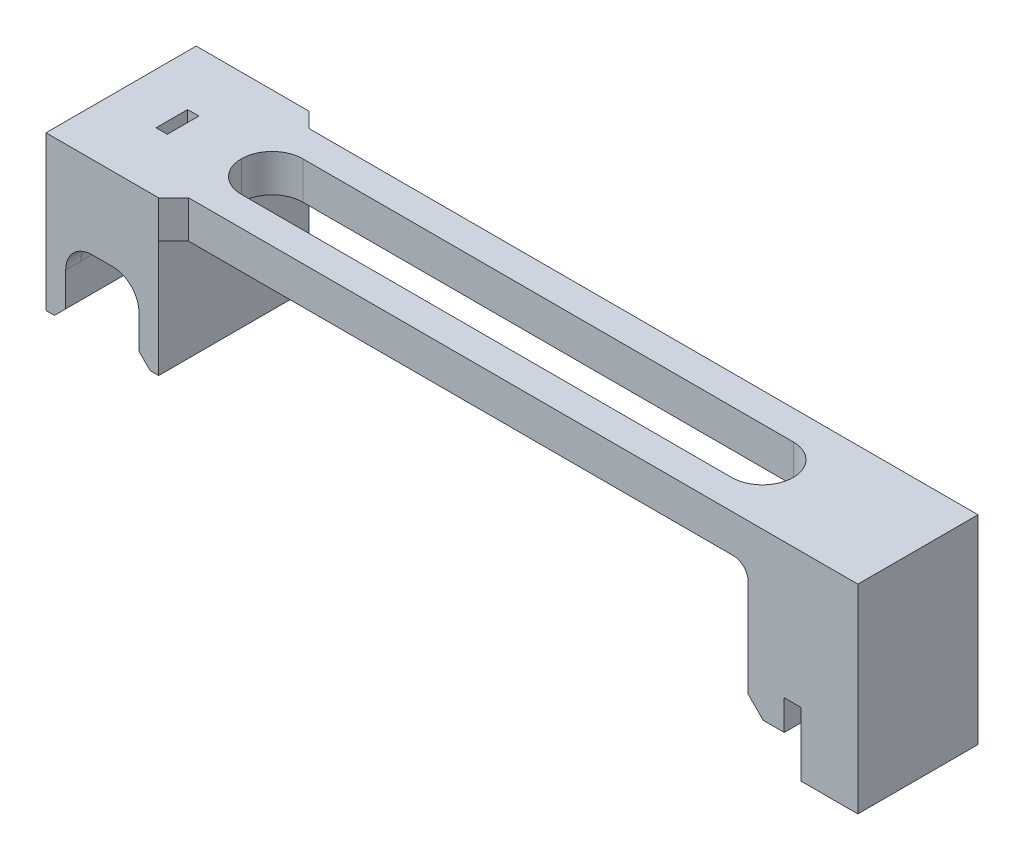
from build123d import *

# Parameters (mm, degrees)
EXTRUDE_1_DEPTH      = 16
SKETCH_4_W           = 1.5
SKETCH_4_H           = 4.2
SKETCH_4_W_2         = 73.5
SKETCH_4_H_2         = 8.2
CUT_EXTRUDE_1_DEPTH  = 10
FILLET_1_R           = 4.1
SKETCH_6_W           = 10
SKETCH_6_H           = 16
SKETCH_6_W_2         = 1.5
SKETCH_6_H_2         = 4.2
EXTRUDE_4_DEPTH      = 11
EXTRUDE_6_DEPTH      = 13
EXTRUDE_6_DEPTH_BACK = 11
SKETCH_10_W          = 0.125
SKETCH_10_H          = 16
SKETCH_10_W_2        = 2.5
FILLET_2_R           = 3.5
EXTRUDE_7_DEPTH      = 2
EXTRUDE_8_DEPTH      = 2
FILLET_4_R           = 3.5
CUT_EXTRUDE_START    = -15
SKETCH_13_W          = 20
SKETCH_13_H          = 3.5
CUT_EXTRUDE_2_DEPTH  = 15
CHAMFER_1_SIZE       = 2
CHAMFER_2_SIZE       = 1.5
SKETCH_14_W          = 7
SKETCH_14_H          = 16
EXTRUDE_9_DEPTH      = 13
SKETCH_15_W          = 4.8
SKETCH_15_H          = 16
EXTRUDE_10_DEPTH     = 4
FILLET_5_R           = 2
CHAMFER_3_SIZE       = 2


with BuildPart() as part:
    # 스케치1 → 보스-돌출1 (new body)
    with BuildSketch(Plane.XY):
        Polygon((-96, 0), (0, 0), (0, -21.5), (7.6, -21.5), (7.6, 5), (-96, 5), align=None)
    extrude(amount=EXTRUDE_1_DEPTH)

    # 스케치4 → 컷-돌출1 (cut)
    with BuildSketch(Plane.XZ):
        with Locations((-91, 8)):
            Rectangle(SKETCH_4_W, SKETCH_4_H)
        with Locations((-45.75, 8)):
            Rectangle(SKETCH_4_W_2, SKETCH_4_H_2)
    extrude(amount=-CUT_EXTRUDE_1_DEPTH, mode=Mode.SUBTRACT)

    # 필렛1
    fillet_1_edges = [part.edges().sort_by_distance(p)[0] for p in [
        (-82.5, 2.5, 3.9),
        (-82.5, 2.5, 12.1),
        (-9, 2.5, 3.9),
        (-9, 2.5, 12.1),
    ]]
    fillet(fillet_1_edges, radius=FILLET_1_R - 0.0001)  # a hair under: the kernel refuses the full size

    # 스케치6 → 보스-돌출4 (add)
    with BuildSketch(Plane(origin=(0, 5, 0), x_dir=(1, 0, 0), z_dir=(0, 1, 0))):
        with Locations((-91, -8)):
            Rectangle(SKETCH_6_W, SKETCH_6_H)
        with Locations((-91, -8)):
            Rectangle(SKETCH_6_W_2, SKETCH_6_H_2, mode=Mode.SUBTRACT)
    extrude(amount=-EXTRUDE_4_DEPTH)

    # 스케치10 → 보스-돌출6 (add, two sides: drawn at the far end of the back side and taken through both)
    with BuildSketch(Plane.XZ.offset(6).offset(-EXTRUDE_6_DEPTH_BACK)):
        with Locations((-95.9375, 8)):
            Rectangle(SKETCH_10_W, SKETCH_10_H)
        with Locations((-97.25, 8)):
            Rectangle(SKETCH_10_W_2, SKETCH_10_H)
        with Locations((-86.0625, 8)):
            Rectangle(SKETCH_10_W, SKETCH_10_H)
        with Locations((-84.75, 8)):
            Rectangle(SKETCH_10_W_2, SKETCH_10_H)
    extrude(amount=EXTRUDE_6_DEPTH + EXTRUDE_6_DEPTH_BACK)

    # 필렛2
    fillet_2_edges = [part.edges().sort_by_distance(p)[0] for p in [
        (-95.875, -6, 8),
        (-86.125, -6, 8),
    ]]
    fillet(fillet_2_edges, radius=FILLET_2_R)

    # 스케치11 → 보스-돌출7 (add)
    with BuildSketch(Plane.XY.offset(16)):
        Polygon((-98.5, 5), (-98.5, -19), (-95.875, -19), (-95.875, -6), (-86.125, -6), (-86.125, -19), (-83.5, -19), (-83.5, 5), align=None)
    extrude(amount=EXTRUDE_7_DEPTH)

    # 스케치12 → 보스-돌출8 (add)
    with BuildSketch(Plane(origin=(0, 0, 0), x_dir=(-1, 0, 0), z_dir=(0, 0, -1))):
        Polygon((83.5, 5), (83.5, -19), (86.125, -19), (86.125, -6), (95.875, -6), (95.875, -19), (98.5, -19), (98.5, 5), align=None)
    extrude(amount=EXTRUDE_8_DEPTH)

    # 필렛4
    fillet_4_edges = [part.edges().sort_by_distance(p)[0] for p in [
        (-95.875, -6, -1),
        (-86.125, -6, -1),
        (-86.125, -6, 17),
        (-95.875, -6, 17),
    ]]
    fillet(fillet_4_edges, radius=FILLET_4_R)

    # 스케치13 → 컷-돌출2 (cut)
    with BuildSketch(Plane.ZY.offset(98.5).offset(CUT_EXTRUDE_START)):
        with Locations((8, -17.25)):
            Rectangle(SKETCH_13_W, SKETCH_13_H)
    extrude(amount=CUT_EXTRUDE_2_DEPTH, mode=Mode.SUBTRACT)

    # 모따기1
    chamfer_1_edges = [part.edges().sort_by_distance(p)[0] for p in [
        (-83.5, 2.5, 0),
        (-83.5, 2.5, 16),
    ]]
    chamfer(chamfer_1_edges, length=CHAMFER_1_SIZE - 0.0001)  # a hair under: the kernel refuses the full size

    # 모따기2
    chamfer_2_edges = [part.edges().sort_by_distance(p)[0] for p in [
        (-95.875, -15.5, 8),
        (-86.125, -15.5, 8),
    ]]
    chamfer(chamfer_2_edges, length=CHAMFER_2_SIZE)

    # 스케치14 → 보스-돌출9 (add)
    with BuildSketch(Plane.XZ):
        with Locations((-3.5, 8)):
            Rectangle(SKETCH_14_W, SKETCH_14_H)
    extrude(amount=EXTRUDE_9_DEPTH)

    # 스케치15 → 보스-돌출10 (add)
    with BuildSketch(Plane.XZ.offset(13)):
        with Locations((-4.6, 8)):
            Rectangle(SKETCH_15_W, SKETCH_15_H)
    extrude(amount=EXTRUDE_10_DEPTH)

    # 필렛5
    fillet_5_edges = [part.edges().sort_by_distance(p)[0] for p in [
        (-7, 0, 8),
    ]]
    fillet(fillet_5_edges, radius=FILLET_5_R - 0.0001)  # a hair under: the kernel refuses the full size

    # 모따기3
    chamfer_3_edges = [part.edges().sort_by_distance(p)[0] for p in [
        (-7, -17, 8),
    ]]
    chamfer(chamfer_3_edges, length=CHAMFER_3_SIZE)


solid = part.part
